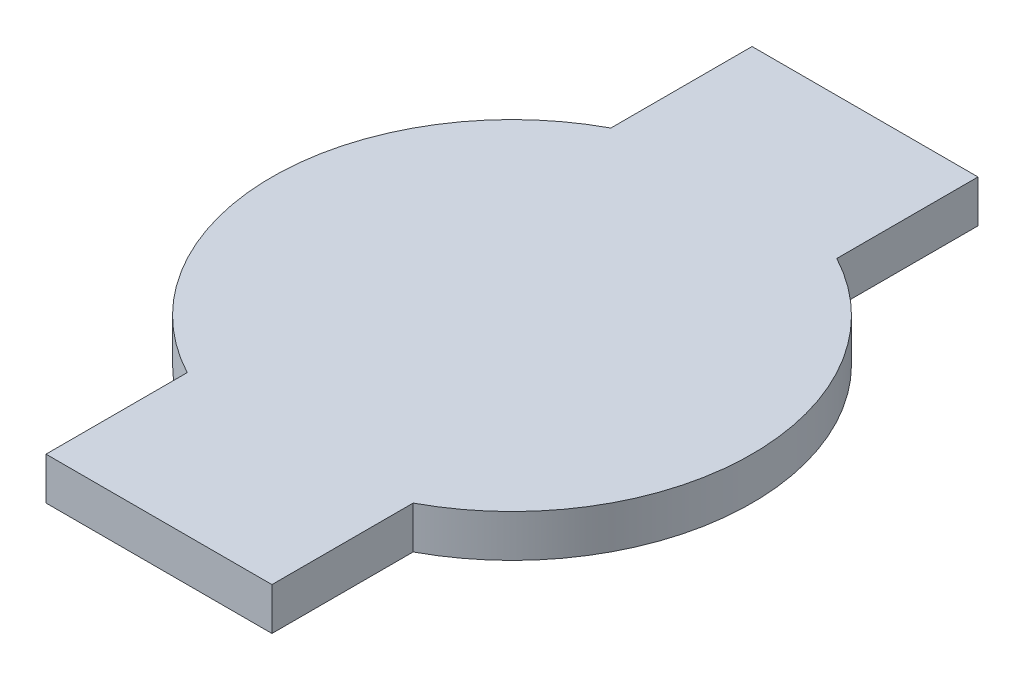
from build123d import *

# Parameters (mm, degrees)
ESTRUSIONE_ESTRUSIONE1_DEPTH = 3


with BuildPart() as part:
    # Schizzo1 → Estrusione-Estrusione1 (new body)
    with BuildSketch(Plane(origin=(0, 0, 0), x_dir=(1, 0, 0), z_dir=(0, 1, 0))):
        with BuildLine():
            Line((8, 25), (-8, 25))
            Line((-8, 25), (-8, 15))
            ThreePointArc((-8, 15), (-17, 0), (-8, -15))
            Line((-8, -15), (-8, -25))
            Line((-8, -25), (8, -25))
            Line((8, -25), (8, -15))
            ThreePointArc((8, -15), (17, 0), (8, 15))
            Line((8, 15), (8, 25))
        make_face()
    extrude(amount=ESTRUSIONE_ESTRUSIONE1_DEPTH)


solid = part.part
